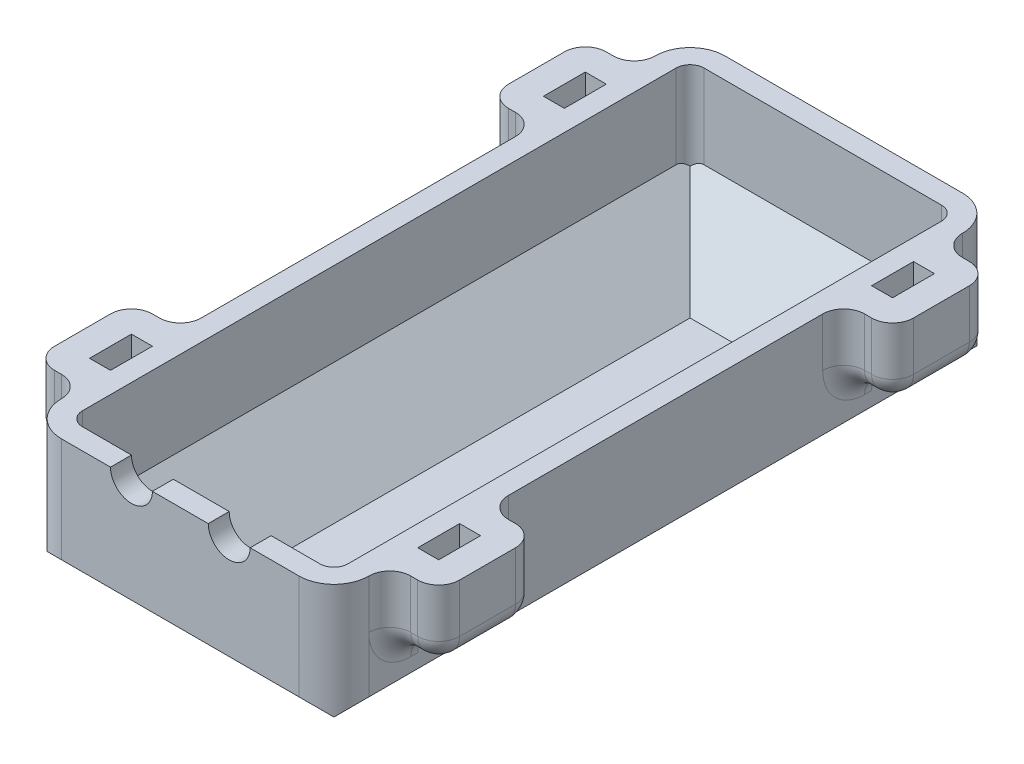
from build123d import *

# Parameters (mm, degrees)
SKETCH1_W               = 44
SKETCH1_H               = 95
BOSS_EXTRUDE1_DEPTH     = 25
SKETCH2_W               = 38
SKETCH2_H               = 89
CUT_EXTRUDE1_DEPTH      = 22
CHAMFER1_SIZE           = 10
FILLET1_R               = 2
FILLET2_R               = 5
SKETCH3_W               = 14
SKETCH3_H               = 10
BOSS_EXTRUDE2_DEPTH     = 7
SKETCH5_W               = 14
SKETCH5_H               = 10
BOSS_EXTRUDE3_DEPTH     = 7
FILLET3_R               = 3
CUT_EXTRUDE2_DEPTH      = 62.010245041
CUT_EXTRUDE2_DEPTH_BACK = 62.010245041
SKETCH7_W               = 3
SKETCH7_H               = 6
SKETCH8_R               = 3
CUT_EXTRUDE3_DEPTH      = 10


with BuildPart() as part:
    # Sketch1 → Boss-Extrude1 (new body)
    with BuildSketch(Plane(origin=(0, 0, 0), x_dir=(1, 0, 0), z_dir=(0, 1, 0))):
        Rectangle(SKETCH1_W, SKETCH1_H)
    extrude(amount=BOSS_EXTRUDE1_DEPTH)

    # Sketch2 → Cut-Extrude1 (cut)
    with BuildSketch(Plane(origin=(0, 25, 0), x_dir=(1, 0, 0), z_dir=(0, 1, 0))):
        Rectangle(SKETCH2_W, SKETCH2_H)
    extrude(amount=-CUT_EXTRUDE1_DEPTH, mode=Mode.SUBTRACT)

    # Chamfer1
    chamfer1_edges = [part.edges().sort_by_distance(p)[0] for p in [
        (-19, 3, 0),
        (0, 3, -44.5),
        (19, 3, 0),
        (0, 3, 44.5),
        (0, 0, 47.5),
        (-22, 0, 0),
        (0, 0, -47.5),
        (22, 0, 0),
    ]]
    chamfer(chamfer1_edges, length=CHAMFER1_SIZE)

    # Fillet1
    fillet1_edges = [part.edges().sort_by_distance(p)[0] for p in [
        (-19, 19, -44.5),
        (19, 19, -44.5),
        (19, 19, 44.5),
        (-19, 19, 44.5),
    ]]
    fillet(fillet1_edges, radius=FILLET1_R)

    # Fillet2
    fillet2_edges = [part.edges().sort_by_distance(p)[0] for p in [
        (22, 17.5, 47.5),
        (-22, 17.5, 47.5),
        (-22, 17.5, -47.5),
        (22, 17.5, -47.5),
    ]]
    fillet(fillet2_edges, radius=FILLET2_R)

    # Sketch3 → Boss-Extrude2 (add)
    with BuildSketch(Plane(origin=(22, 0, 0), x_dir=(0, 0, -1), z_dir=(1, 0, 0))):
        with Locations((-32.5, 20)):
            Rectangle(SKETCH3_W, SKETCH3_H)
        with Locations((32.5, 20)):
            Rectangle(SKETCH3_W, SKETCH3_H)
    extrude(amount=BOSS_EXTRUDE2_DEPTH)

    # Sketch5 → Boss-Extrude3 (add)
    with BuildSketch(Plane.ZY.offset(22)):
        with Locations((32.5, 20)):
            Rectangle(SKETCH5_W, SKETCH5_H)
        with Locations((-32.5, 20)):
            Rectangle(SKETCH5_W, SKETCH5_H)
    extrude(amount=BOSS_EXTRUDE3_DEPTH)

    # Fillet3
    fillet3_edges = [part.edges().sort_by_distance(p)[0] for p in [
        (22, 20, 39.5),
        (22, 15, 32.5),
        (25.5, 15, 39.5),
        (22, 20, 25.5),
        (25.5, 15, 25.5),
        (29, 20, 39.5),
        (29, 15, 32.5),
        (29, 20, 25.5),
        (22, 20, -25.5),
        (22, 15, -32.5),
        (25.5, 15, -25.5),
        (22, 20, -39.5),
        (25.5, 15, -39.5),
        (29, 20, -25.5),
        (29, 15, -32.5),
        (29, 20, -39.5),
        (-22, 20, 39.5),
        (-25.5, 15, 39.5),
        (-22, 20, 25.5),
        (-22, 15, 32.5),
        (-25.5, 15, 25.5),
        (-29, 20, 39.5),
        (-29, 20, 25.5),
        (-29, 15, 32.5),
        (-22, 15, -32.5),
        (-25.5, 15, -39.5),
        (-22, 20, -25.5),
        (-25.5, 15, -25.5),
        (-22, 20, -39.5),
        (-29, 15, -32.5),
        (-29, 20, -25.5),
        (-29, 20, -39.5),
    ]]
    fillet(fillet3_edges, radius=FILLET3_R - 0.0001)  # a hair under: the kernel refuses the full size

    # Sketch7 → Cut-Extrude2 (cut, two sides: drawn at the far end of the back side and taken through both)
    with BuildSketch(Plane(origin=(0, 25, 0), x_dir=(1, 0, 0), z_dir=(0, 1, 0)).offset(-CUT_EXTRUDE2_DEPTH_BACK)):
        with Locations((-23.5, 32.5)):
            Rectangle(SKETCH7_W, SKETCH7_H)
        with Locations((23.5, 32.5)):
            Rectangle(SKETCH7_W, SKETCH7_H)
        with Locations((23.5, -32.5)):
            Rectangle(SKETCH7_W, SKETCH7_H)
        with Locations((-23.5, -32.5)):
            Rectangle(SKETCH7_W, SKETCH7_H)
    extrude(amount=CUT_EXTRUDE2_DEPTH + CUT_EXTRUDE2_DEPTH_BACK, mode=Mode.SUBTRACT)

    # Sketch8 → Cut-Extrude3 (cut)
    with BuildSketch(Plane.XY.offset(47.5)):
        with Locations((7, 25)):
            Circle(SKETCH8_R)
        with Locations((-7, 25)):
            Circle(SKETCH8_R)
    extrude(amount=-CUT_EXTRUDE3_DEPTH, mode=Mode.SUBTRACT)


solid = part.part
